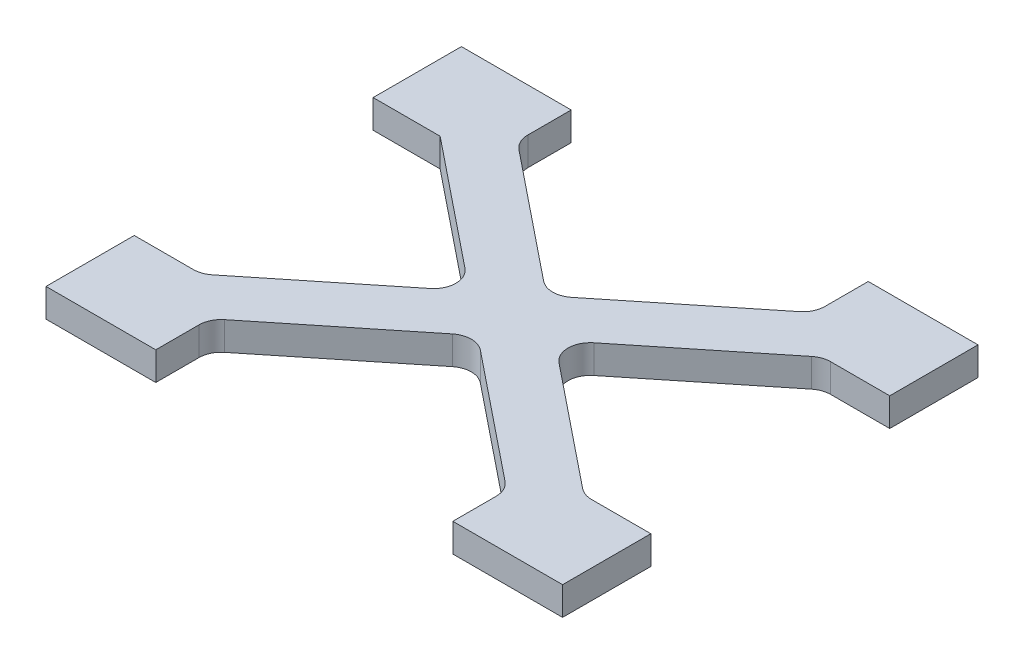
from build123d import *

# Parameters (mm, degrees)
BOSS_EXTRUDE1_DEPTH = 6.35
FILLET1_R           = 5


with BuildPart() as part:
    # Sketch1 → Boss-Extrude1 (new body)
    with BuildSketch(Plane(origin=(0, 0, 0), x_dir=(1, 0, 0), z_dir=(0, 1, 0))):
        Polygon((-57.825, 26.738412941), (-42.825, 26.738412941), (-9.574489714, 0), (-42.825, -26.738412941), (-57.825, -26.738412941), (-57.825, -46.5), (-33.250510286, -46.5), (-33.250510286, -34.437743191), (0, -7.69933025), (33.250510286, -34.437743191), (33.250510286, -46.5), (57.825, -46.5), (57.825, -26.738412941), (42.825, -26.738412941), (9.574489714, 0), (42.825, 26.738412941), (57.825, 26.738412941), (57.825, 46.5), (33.250510286, 46.5), (33.250510286, 34.437743191), (0, 7.69933025), (-33.250510286, 34.437743191), (-33.250510286, 46.5), (-57.825, 46.5), align=None)
    extrude(amount=BOSS_EXTRUDE1_DEPTH)

    # Fillet1
    fillet1_edges = [part.edges().sort_by_distance(p)[0] for p in [
        (-33.250510286, 3.175, -34.437743191),
        (33.250510286, 3.175, -34.437743191),
        (42.825, 3.175, -26.738412941),
        (42.825, 3.175, 26.738412941),
        (33.250510286, 3.175, 34.437743191),
        (-33.250510286, 3.175, 34.437743191),
        (-42.825, 3.175, 26.738412941),
        (-9.574489714, 3.175, 0),
        (0, 3.175, -7.69933025),
        (9.574489714, 3.175, 0),
        (0, 3.175, 7.69933025),
    ]]
    fillet(fillet1_edges, radius=FILLET1_R)


solid = part.part
